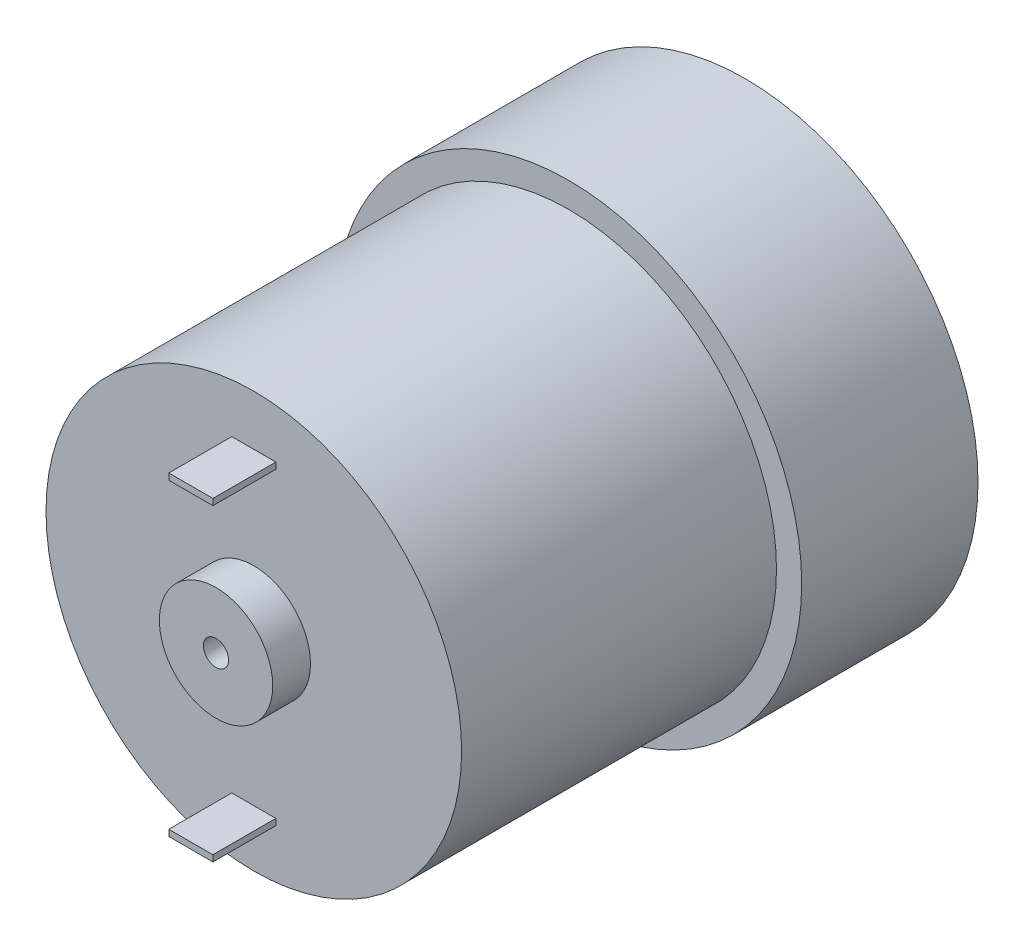
from build123d import *

# Parameters (mm, degrees)
SKETCH1_R                 = 18.5
BOSS_EXTRUDE1_DEPTH       = 42
CUT_EXTRUDE1_START        = -3
SKETCH2_R                 = 18.5
SKETCH2_R_2               = 4.5
CUT_EXTRUDE1_DEPTH        = 3
CUT_EXTRUDE4_START        = -25
SKETCH3_R                 = 18.5
SKETCH3_R_2               = 16.5
CUT_EXTRUDE4_DEPTH        = 25
SKETCH4_R                 = 6
BOSS_EXTRUDE2_DEPTH       = 4.6
FILLET1_R                 = 0.5
SKETCH5_R                 = 3
CUT_EXTRUDE5_DEPTH        = 10
SKETCH6_R                 = 1
CUT_EXTRUDE6_DEPTH        = 10
SKETCH7_W                 = 3.5
SKETCH7_H                 = 0.5
BOSS_EXTRUDE3_DEPTH       = 5
M3X0_5_TAPPED_HOLE1_D     = 2.5
M3X0_5_TAPPED_HOLE1_DEPTH = 7.5
M3X0_5_TAPPED_HOLE1_TIP   = 0.751075774
F_3_0MM_DOWEL_HOLE1_D     = 3
F_3_0MM_DOWEL_HOLE1_DEPTH = 7.5
F_3_0MM_DOWEL_HOLE1_TIP   = 0.901290929


with BuildPart() as part:
    # Sketch1 → Boss-Extrude1 (new body)
    with BuildSketch(Plane.XY):
        Circle(SKETCH1_R)
    extrude(amount=BOSS_EXTRUDE1_DEPTH)

    # Sketch2 → Cut-Extrude1 (cut)
    with BuildSketch(Plane.XY.offset(42).offset(CUT_EXTRUDE1_START)):
        Circle(SKETCH2_R)
        Circle(SKETCH2_R_2, mode=Mode.SUBTRACT)
    extrude(amount=CUT_EXTRUDE1_DEPTH, mode=Mode.SUBTRACT)

    # Sketch3 → Cut-Extrude4 (cut)
    with BuildSketch(Plane.XY.offset(39).offset(CUT_EXTRUDE4_START)):
        Circle(SKETCH3_R)
        Circle(SKETCH3_R_2, mode=Mode.SUBTRACT)
    extrude(amount=CUT_EXTRUDE4_DEPTH, mode=Mode.SUBTRACT)

    # Sketch4 → Boss-Extrude2 (add)
    with BuildSketch(Plane(origin=(0, 0, 0), x_dir=(-1, 0, 0), z_dir=(0, 0, -1))):
        with Locations((0, -7)):
            Circle(SKETCH4_R)
    extrude(amount=BOSS_EXTRUDE2_DEPTH)

    # Fillet1
    fillet1_edges = [part.edges().sort_by_distance(p)[0] for p in [
        (6, -7, -4.6),
    ]]
    fillet(fillet1_edges, radius=FILLET1_R)

    # Sketch5 → Cut-Extrude5 (cut)
    with BuildSketch(Plane(origin=(0, 0, -4.6), x_dir=(-1, 0, 0), z_dir=(0, 0, -1))):
        with Locations((0, -7)):
            Circle(SKETCH5_R)
    extrude(amount=-CUT_EXTRUDE5_DEPTH, mode=Mode.SUBTRACT)

    # Sketch6 → Cut-Extrude6 (cut)
    with BuildSketch(Plane.XY.offset(42)):
        Circle(SKETCH6_R)
    extrude(amount=-CUT_EXTRUDE6_DEPTH, mode=Mode.SUBTRACT)

    # Sketch7 → Boss-Extrude3 (add)
    with BuildSketch(Plane.XY.offset(39)):
        with Locations((0, 12.25)):
            Rectangle(SKETCH7_W, SKETCH7_H)
        with Locations((0, -12.25)):
            Rectangle(SKETCH7_W, SKETCH7_H)
    extrude(amount=BOSS_EXTRUDE3_DEPTH)

    # M3x0.5 Tapped Hole1
    with Locations(Plane(origin=(0, 0, 0), x_dir=(-1, 0, 0), z_dir=(0, 0, -1))):
        with Locations((15.5, 0), (-7.75, 13.423393759), (-7.75, -13.423393759), (-15.5, 0)):
            Hole(M3X0_5_TAPPED_HOLE1_D / 2, depth=M3X0_5_TAPPED_HOLE1_DEPTH)
            with Locations((0, 0, -(M3X0_5_TAPPED_HOLE1_DEPTH + M3X0_5_TAPPED_HOLE1_TIP / 2))):  # 118° drill point
                Cone(0, M3X0_5_TAPPED_HOLE1_D / 2, M3X0_5_TAPPED_HOLE1_TIP, mode=Mode.SUBTRACT)

    # Ø3.0mm Dowel Hole1
    with Locations(Plane(origin=(0, 0, 0), x_dir=(-1, 0, 0), z_dir=(0, 0, -1))):
        with Locations((0, 15.5), (-13.829316686, -7), (13.829316686, -7)):
            Hole(F_3_0MM_DOWEL_HOLE1_D / 2, depth=F_3_0MM_DOWEL_HOLE1_DEPTH)
            with Locations((0, 0, -(F_3_0MM_DOWEL_HOLE1_DEPTH + F_3_0MM_DOWEL_HOLE1_TIP / 2))):  # 118° drill point
                Cone(0, F_3_0MM_DOWEL_HOLE1_D / 2, F_3_0MM_DOWEL_HOLE1_TIP, mode=Mode.SUBTRACT)


solid = part.part
